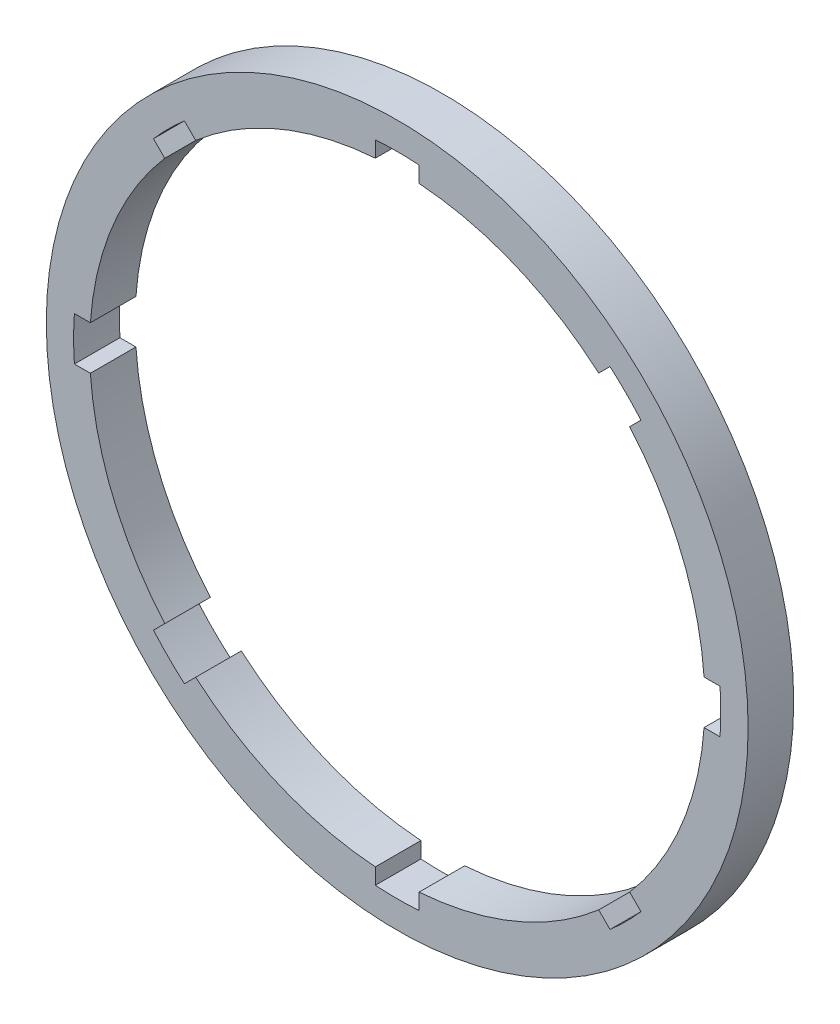
from build123d import *

# Parameters (mm, degrees)
CROQUIS1_R              = 38.5
SALIENTE_EXTRUIR4_DEPTH = 5


with BuildPart() as part:
    # Croquis1 → Saliente-Extruir4 (new body)
    with BuildSketch(Plane.XY):
        Circle(CROQUIS1_R)
        with BuildLine():
            Line((-2.4, 33.664558515), (-2.4, 35.418780329))
            ThreePointArc((-2.4, 35.418780329), (0, 35.5), (2.4, 35.418780329))
            Line((2.4, 35.418780329), (2.4, 33.664558515))
            ThreePointArc((2.4, 33.664558515), (12.915565842, 31.180934222), (22.107381337, 25.501493886))
            Line((22.107381337, 25.501493886), (23.347803477, 26.741916027))
            ThreePointArc((23.347803477, 26.741916027), (25.102290732, 25.102290732), (26.741916027, 23.347803477))
            Line((26.741916027, 23.347803477), (25.501493886, 22.107381337))
            ThreePointArc((25.501493886, 22.107381337), (31.180934222, 12.915565842), (33.664558515, 2.4))
            Line((33.664558515, 2.4), (35.418780329, 2.4))
            ThreePointArc((35.418780329, 2.4), (35.5, 0), (35.418780329, -2.4))
            Line((35.418780329, -2.4), (33.664558515, -2.4))
            ThreePointArc((33.664558515, -2.4), (31.180934222, -12.915565842), (25.501493886, -22.107381337))
            Line((25.501493886, -22.107381337), (26.741916027, -23.347803477))
            ThreePointArc((26.741916027, -23.347803477), (25.102290732, -25.102290732), (23.347803477, -26.741916027))
            Line((23.347803477, -26.741916027), (22.107381337, -25.501493886))
            ThreePointArc((22.107381337, -25.501493886), (12.915565842, -31.180934222), (2.4, -33.664558515))
            Line((2.4, -33.664558515), (2.4, -35.418780329))
            ThreePointArc((2.4, -35.418780329), (0, -35.5), (-2.4, -35.418780329))
            Line((-2.4, -35.418780329), (-2.4, -33.664558515))
            ThreePointArc((-2.4, -33.664558515), (-12.915565842, -31.180934222), (-22.107381337, -25.501493886))
            Line((-22.107381337, -25.501493886), (-23.347803477, -26.741916027))
            ThreePointArc((-23.347803477, -26.741916027), (-25.102290732, -25.102290732), (-26.741916027, -23.347803477))
            Line((-26.741916027, -23.347803477), (-25.501493886, -22.107381337))
            ThreePointArc((-25.501493886, -22.107381337), (-31.180934222, -12.915565842), (-33.664558515, -2.4))
            Line((-33.664558515, -2.4), (-35.418780329, -2.4))
            ThreePointArc((-35.418780329, -2.4), (-35.5, 0), (-35.418780329, 2.4))
            Line((-35.418780329, 2.4), (-33.664558515, 2.4))
            ThreePointArc((-33.664558515, 2.4), (-31.180934222, 12.915565842), (-25.501493886, 22.107381337))
            Line((-25.501493886, 22.107381337), (-26.741916027, 23.347803477))
            ThreePointArc((-26.741916027, 23.347803477), (-25.102290732, 25.102290732), (-23.347803477, 26.741916027))
            Line((-23.347803477, 26.741916027), (-22.107381337, 25.501493886))
            ThreePointArc((-22.107381337, 25.501493886), (-12.915565842, 31.180934222), (-2.4, 33.664558515))
        make_face(mode=Mode.SUBTRACT)
    extrude(amount=SALIENTE_EXTRUIR4_DEPTH)


solid = part.part
